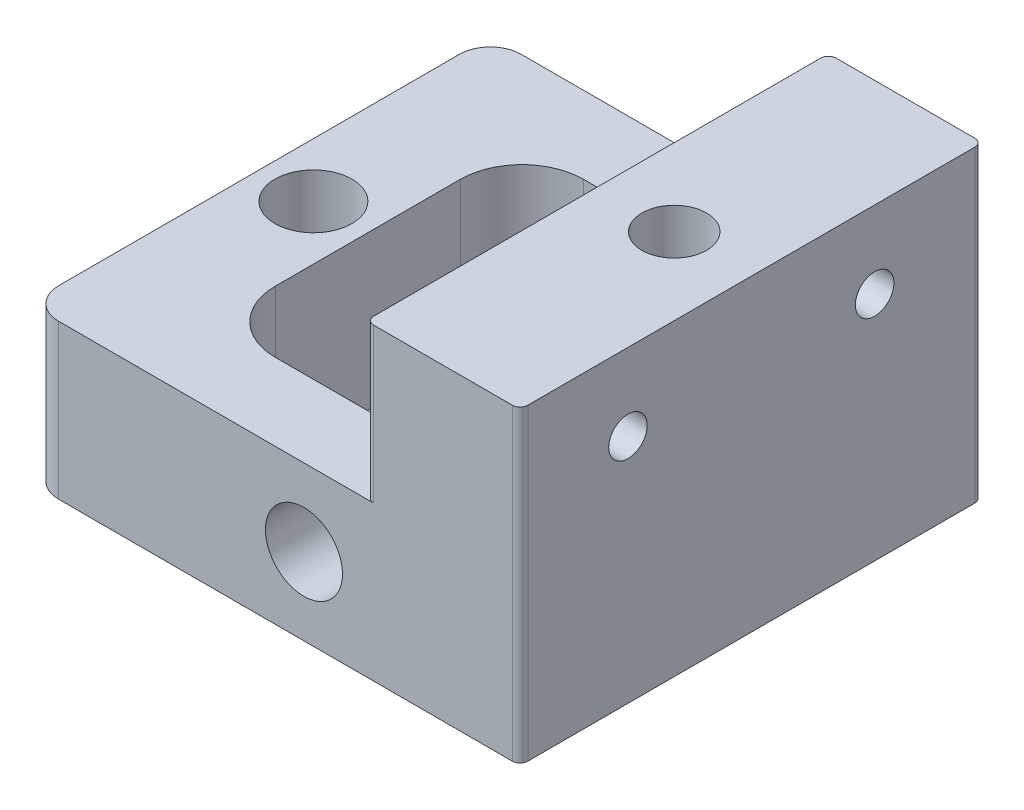
from build123d import *

# Parameters (mm, degrees)
SKETCH1_W                   = 31.93
SKETCH1_H                   = 30
SKETCH1_W_2                 = 14.88
SKETCH1_H_2                 = 20
BOSS_EXTRUDE1_DEPTH         = 10
SKETCH2_W                   = 10
SKETCH2_H                   = 30
BOSS_EXTRUDE2_DEPTH         = 10
TAP_DRILL_FOR_M5X0_8_TAP1_D = 4.2
FILLET2_R                   = 4
SKETCH5_R                   = 2.5
CUT_EXTRUDE2_DEPTH          = 41.051886348
FILLET3_R                   = 2
FILLET4_R                   = 0.5
TAP_DRILL_FOR_M3X0_5_TAP1_D = 2.5
F_5_0_5_DIAMETER_HOLE1_D    = 5


with BuildPart() as part:
    # Sketch1 → Boss-Extrude1 (new body)
    with BuildSketch(Plane(origin=(0, 0, 0), x_dir=(1, 0, 0), z_dir=(0, 1, 0))):
        with Locations((1.475, 0)):
            Rectangle(SKETCH1_W, SKETCH1_H)
        Rectangle(SKETCH1_W_2, SKETCH1_H_2, mode=Mode.SUBTRACT)
    extrude(amount=BOSS_EXTRUDE1_DEPTH)

    # Sketch2 → Boss-Extrude2 (add)
    with BuildSketch(Plane(origin=(0, 10, 0), x_dir=(1, 0, 0), z_dir=(0, 1, 0))):
        with Locations((12.44, 0)):
            Rectangle(SKETCH2_W, SKETCH2_H)
    extrude(amount=BOSS_EXTRUDE2_DEPTH)

    # Tap Drill for M5x0.8 Tap1 (through all)
    with Locations(Plane(origin=(0, 20, 0), x_dir=(1, 0, 0), z_dir=(0, 1, 0))):
        with Locations((12.44, 0)):
            Hole(TAP_DRILL_FOR_M5X0_8_TAP1_D / 2)

    # Fillet2
    fillet2_edges = [part.edges().sort_by_distance(p)[0] for p in [
        (-7.44, 5, 10),
        (-7.44, 5, -10),
        (7.44, 5, -10),
        (7.44, 5, 10),
    ]]
    fillet(fillet2_edges, radius=FILLET2_R)

    # Sketch5 → Cut-Extrude2 (cut, through all)
    with BuildSketch(Plane.XY.offset(-15)):
        with Locations((3.42, 5)):
            Circle(SKETCH5_R)
    extrude(amount=CUT_EXTRUDE2_DEPTH, mode=Mode.SUBTRACT)

    # Fillet3
    fillet3_edges = [part.edges().sort_by_distance(p)[0] for p in [
        (-14.49, 5, -15),
        (-14.49, 5, 15),
    ]]
    fillet(fillet3_edges, radius=FILLET3_R)

    # Fillet4
    fillet4_edges = [part.edges().sort_by_distance(p)[0] for p in [
        (17.44, 10, 15),
        (17.44, 10, -15),
        (7.44, 15, -15),
        (7.44, 15, 15),
    ]]
    fillet(fillet4_edges, radius=FILLET4_R)

    # Tap Drill for M3x0.5 Tap1 (through all)
    with Locations(Plane.ZY.offset(-7.44)):
        with Locations((-8, 15), (8, 15)):
            Hole(TAP_DRILL_FOR_M3X0_5_TAP1_D / 2)

    # Ø5.0 (5) Diameter Hole1 (through all)
    with Locations(Plane(origin=(0, 10, 0), x_dir=(1, 0, 0), z_dir=(0, 1, 0))):
        with Locations((-10.965, 0)):
            Hole(F_5_0_5_DIAMETER_HOLE1_D / 2)


solid = part.part
